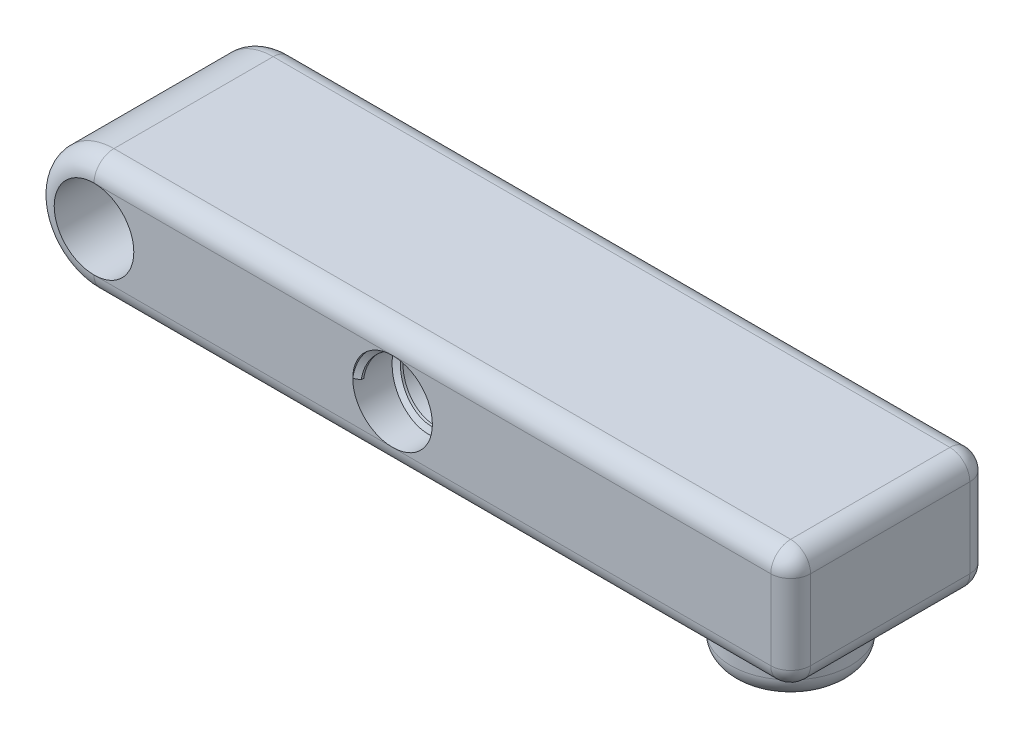
from build123d import *

# Parameters (mm, degrees)
SKETCH1_R                = 15
SKETCH1_R_2              = 10
BOSS_EXTRUDE1_DEPTH      = 50
BOSS_EXTRUDE2_DEPTH      = 15
BOSS_EXTRUDE2_DEPTH_BACK = 15
SKETCH2_W                = 175
SKETCH2_H                = 50
CUT_EXTRUDE1_DEPTH       = 183.619823677
CUT_EXTRUDE1_DEPTH_BACK  = 183.619823677
SKETCH3_R                = 10
SKETCH4_R                = 15
SKETCH4_R_2              = 10
BOSS_EXTRUDE3_DEPTH      = 15
FILLET1_R                = 5
FILLET2_R                = 5
FILLET3_R                = 5
FILLET4_R                = 5
FILLET5_R                = 5
SKETCH6_R                = 10
CUT_EXTRUDE2_DEPTH       = 52
THREAD1_PITCH            = 10
CUT_EXTRUDE3_DEPTH       = 171


with BuildPart() as part:
    # Sketch1 → Boss-Extrude1 (new body)
    with BuildSketch(Plane.XY):
        Circle(SKETCH1_R)
        Circle(SKETCH1_R_2, mode=Mode.SUBTRACT)
    extrude(amount=BOSS_EXTRUDE1_DEPTH)

    # Sketch2 → Boss-Extrude2 (add, two sides: drawn at the far end of the back side and taken through both)
    with BuildSketch(Plane(origin=(0, 0, 0), x_dir=(1, 0, 0), z_dir=(0, 1, 0)).offset(-BOSS_EXTRUDE2_DEPTH_BACK)):
        with Locations((87.5, -25)):
            Rectangle(SKETCH2_W, SKETCH2_H)
    extrude(amount=BOSS_EXTRUDE2_DEPTH + BOSS_EXTRUDE2_DEPTH_BACK)

    # Sketch3 → Cut-Extrude1 (cut, two sides: drawn at the far end of the back side and taken through both)
    with BuildSketch(Plane.XY.offset(50).offset(-CUT_EXTRUDE1_DEPTH_BACK)):
        Circle(SKETCH3_R)
    extrude(amount=CUT_EXTRUDE1_DEPTH + CUT_EXTRUDE1_DEPTH_BACK, mode=Mode.SUBTRACT)

    # Sketch4 → Boss-Extrude3 (add)
    with BuildSketch(Plane.XZ.offset(15)):
        with Locations(Location((150, 25, 0), (0, 0, 90))):
            Circle(SKETCH4_R)
        with Locations(Location((150, 25, 0), (0, 0, 270))):
            Circle(SKETCH4_R_2, mode=Mode.SUBTRACT)
    extrude(amount=BOSS_EXTRUDE3_DEPTH)

    # Fillet1
    fillet1_edges = [part.edges().sort_by_distance(p)[0] for p in [
        (150, -15, 10),
    ]]
    fillet(fillet1_edges, radius=FILLET1_R)

    # Fillet2
    fillet2_edges = [part.edges().sort_by_distance(p)[0] for p in [
        (175, 15, 25),
    ]]
    fillet(fillet2_edges, radius=FILLET2_R)

    # Fillet3
    fillet3_edges = [part.edges().sort_by_distance(p)[0] for p in [
        (175, -15, 25),
    ]]
    fillet(fillet3_edges, radius=FILLET3_R - 0.0001)  # a hair under: the kernel refuses the full size

    # Fillet4
    fillet4_edges = [part.edges().sort_by_distance(p)[0] for p in [
        (85.00005, -15, 50),
        (85, 15, 50),
        (-15, 0, 0),
        (-15, 0, 50),
        (85, 15, 0),
        (173.535533906, 13.535533906, 0),
        (173.535533906, 13.535533906, 50),
        (175, -5e-05, 0),
        (175, -5e-05, 50),
        (85.00005, -15, 0),
        (173.535563195, -13.535563195, 0),
        (173.535563195, -13.535563195, 50),
    ]]
    fillet(fillet4_edges, radius=FILLET4_R - 0.0001)  # a hair under: the kernel refuses the full size

    # Fillet5
    fillet5_edges = [part.edges().sort_by_distance(p)[0] for p in [
        (150, -30, 10),
    ]]
    fillet(fillet5_edges, radius=FILLET5_R - 0.0001)  # a hair under: the kernel refuses the full size

    # Sketch6 → Cut-Extrude2 (cut)
    with BuildSketch(Plane.XY.offset(50)):
        with Locations(Location((75, 0, 0), (0, 0, 270))):
            Circle(SKETCH6_R)
    extrude(amount=-CUT_EXTRUDE2_DEPTH, mode=Mode.SUBTRACT)

    # Thread1: the profile of Thread Profile1 profile screwed along a right-hand helix of 5 turns, 16 arcs to a turn; built about Z, then put on its axis
    thread1_z = Axis((0, 0, 0), (0, 0, 1))
    thread1_corners = [(10.0003, 0, -0.000173205), (10.0003, 0, 2.187673198), (8.646835313, 0, 1.406249997), (8.646835313, 0, 0.781249997)]
    with BuildLine(mode=Mode.PRIVATE) as thread1_profile:
        Line(thread1_corners[0], thread1_corners[1])
        Line(thread1_corners[1], thread1_corners[2])
        Line(thread1_corners[2], thread1_corners[3])
        Line(thread1_corners[3], thread1_corners[0])
    thread1_cap = Face(thread1_profile.wire())
    thread1_turn_angles = [0, 11.25, 22.5, 33.75, 45, 56.25, 67.5, 78.75, 90, 101.25, 112.5, 123.75, 135, 146.25, 157.5, 168.75, 180, 191.25, 202.5, 213.75, 225, 236.25, 247.5, 258.75, 270, 281.25, 292.5, 303.75, 315, 326.25, 337.5, 348.75, 360]
    thread1_turn_weights = [1, 0.9807852804032304, 1, 0.9807852804032304, 1, 0.9807852804032304, 1, 0.9807852804032304, 1, 0.9807852804032304, 1, 0.9807852804032304, 1, 0.9807852804032304, 1, 0.9807852804032304, 1, 0.9807852804032304, 1, 0.9807852804032304, 1, 0.9807852804032304, 1, 0.9807852804032304, 1, 0.9807852804032304, 1, 0.9807852804032304, 1, 0.9807852804032304, 1, 0.9807852804032304, 1]
    thread1_turn_rails = [Edge.make_bspline([Vector(p[0], p[1], 0).rotate(thread1_z, thread1_turn_angles[k]) / thread1_turn_weights[k] + Vector(0, 0, p[2] + THREAD1_PITCH * thread1_turn_angles[k] / 360) for k in range(33)], [0, 0, 0, 1, 1, 2, 2, 3, 3, 4, 4, 5, 5, 6, 6, 7, 7, 8, 8, 9, 9, 10, 10, 11, 11, 12, 12, 13, 13, 14, 14, 15, 15, 16, 16, 16], 2, thread1_turn_weights) for p in thread1_corners]
    thread1_turn_sides = [Face.make_surface_from_curves(thread1_turn_rails[p[0]], thread1_turn_rails[p[1]]) for p in [(0, 1), (1, 2), (2, 3), (3, 0)]]
    thread1 = Plane(origin=(75, 0, 50), x_dir=(-1, 0, 0), z_dir=(0, 0, -1)) * Solid(Shell([*[p.moved(Location((0, 0, THREAD1_PITCH * i))) for i in range(5) for p in thread1_turn_sides], thread1_cap, thread1_cap.rotate(thread1_z, 1800).moved(Location((0, 0, THREAD1_PITCH * 1800 / 360)))]))
    add(thread1)

    # Sketch9 → Cut-Extrude3 (cut)
    with BuildSketch(Plane(origin=(175, 0, 0), x_dir=(0, 0, -1), z_dir=(1, 0, 0))):
        Polygon((0, -10), (0, 17.342127845), (14.023858299, 17.342127845), (14.023858299, -16.38295289), (0, -16.38295289), align=None)
    extrude(amount=-CUT_EXTRUDE3_DEPTH, mode=Mode.SUBTRACT)


solid = part.part
